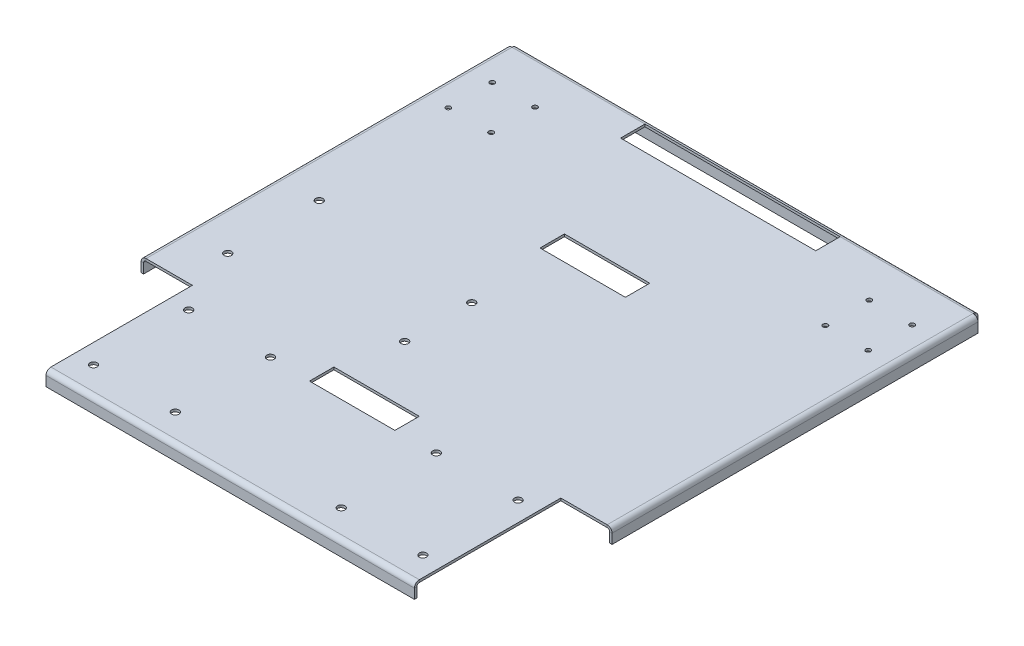
from build123d import *

# Parameters (mm, degrees)
SKETCH1_W          = 189
SKETCH1_H          = 208
BASE_FLANGE1_DEPTH = 1
EDGE_FLANGE1_DEPTH = 189
EDGE_FLANGE2_DEPTH = 208
EDGE_FLANGE3_DEPTH = 189
EDGE_FLANGE4_DEPTH = 208
SKETCH17_W         = 21
SKETCH17_H         = 60
CUT_EXTRUDE1_DEPTH = 144.472122728
SKETCH18_W         = 80
SKETCH18_H         = 10
CUT_EXTRUDE2_DEPTH = 10
SKETCH20_R         = 1.5
CUT_EXTRUDE3_DEPTH = 10
SKETCH21_R         = 1
CUT_EXTRUDE4_DEPTH = 10
SKETCH22_R         = 1.5
CUT_EXTRUDE5_DEPTH = 10
SKETCH23_W         = 35
SKETCH23_H         = 10
CUT_EXTRUDE6_DEPTH = 10


# Sheet-metal steps are written as plain solids
with BuildPart() as part:
    # Sketch1 → Base-Flange1 (new body)
    with BuildSketch(Plane(origin=(0, 0, 0), x_dir=(1, 0, 0), z_dir=(0, 1, 0))):
        Rectangle(SKETCH1_W, SKETCH1_H)
    extrude(amount=-BASE_FLANGE1_DEPTH)

    # Edge-Flange1 section (across the edge) → Edge-Flange1 (add)
    with BuildSketch(Plane(origin=(94.5, -1, 105), x_dir=(0, 0, -1), z_dir=(-1, 0, 0))):
        with BuildLine():
            Line((-1, 1), (-1, 5))
            Line((-1, 5), (0, 5))
            Line((0, 5), (0, 1))
            ThreePointArc((0, 1), (0.292893219, 0.292893219), (1, 0))
            Line((1, 0), (1, -1))
            ThreePointArc((1, -1), (-0.414213562, -0.414213562), (-1, 1))
        make_face()
    extrude(amount=EDGE_FLANGE1_DEPTH)

    # Edge-Flange2 section (across the edge) → Edge-Flange2 (add)
    with BuildSketch(Plane(origin=(95.5, -1, -104), x_dir=(-1, 0, 0), z_dir=(0, 0, 1))):
        with BuildLine():
            Line((-1, 1), (-1, 5))
            Line((-1, 5), (0, 5))
            Line((0, 5), (0, 1))
            ThreePointArc((0, 1), (0.292893219, 0.292893219), (1, 0))
            Line((1, 0), (1, -1))
            ThreePointArc((1, -1), (-0.414213562, -0.414213562), (-1, 1))
        make_face()
    extrude(amount=EDGE_FLANGE2_DEPTH)

    # Edge-Flange3 section (across the edge) → Edge-Flange3 (add)
    with BuildSketch(Plane(origin=(-94.5, -1, -105), x_dir=(0, 0, 1), z_dir=(1, 0, 0))):
        with BuildLine():
            Line((-1, 1), (-1, 5))
            Line((-1, 5), (0, 5))
            Line((0, 5), (0, 1))
            ThreePointArc((0, 1), (0.292893219, 0.292893219), (1, 0))
            Line((1, 0), (1, -1))
            ThreePointArc((1, -1), (-0.414213562, -0.414213562), (-1, 1))
        make_face()
    extrude(amount=EDGE_FLANGE3_DEPTH)

    # Edge-Flange4 section (across the edge) → Edge-Flange4 (add)
    with BuildSketch(Plane(origin=(-95.5, -1, 104), x_dir=(1, 0, 0), z_dir=(0, 0, -1))):
        with BuildLine():
            Line((-1, 1), (-1, 5))
            Line((-1, 5), (0, 5))
            Line((0, 5), (0, 1))
            ThreePointArc((0, 1), (0.292893219, 0.292893219), (1, 0))
            Line((1, 0), (1, -1))
            ThreePointArc((1, -1), (-0.414213562, -0.414213562), (-1, 1))
        make_face()
    extrude(amount=EDGE_FLANGE4_DEPTH)

    # Sketch17 → Cut-Extrude1 (cut, through all)
    with BuildSketch(Plane(origin=(0, 0, 0), x_dir=(1, 0, 0), z_dir=(0, 1, 0))):
        with Locations((86, -76)):
            Rectangle(SKETCH17_W, SKETCH17_H)
        with Locations((-86, -76)):
            Rectangle(SKETCH17_W, SKETCH17_H)
    extrude(amount=-CUT_EXTRUDE1_DEPTH, mode=Mode.SUBTRACT)

    # Sketch18 → Cut-Extrude2 (cut)
    with BuildSketch(Plane(origin=(0, 0, 0), x_dir=(1, 0, 0), z_dir=(0, 1, 0))):
        with Locations((0, 99)):
            Rectangle(SKETCH18_W, SKETCH18_H)
    extrude(amount=-CUT_EXTRUDE2_DEPTH, mode=Mode.SUBTRACT)

    # Sketch20 → Cut-Extrude3 (cut)
    with BuildSketch(Plane(origin=(0, 0, 0), x_dir=(1, 0, 0), z_dir=(0, 1, 0))):
        with Locations(Location((-79.5844, -27.41485418, 0), (0, 0, 270))):
            Circle(SKETCH20_R)
        with Locations(Location((-12.0844, -22.41485418, 0), (0, 0, 270))):
            Circle(SKETCH20_R)
        with Locations(Location((-12.0844, 5.08514582, 0), (0, 0, 270))):
            Circle(SKETCH20_R)
        with Locations(Location((-79.5844, 10.08514582, 0), (0, 0, 270))):
            Circle(SKETCH20_R)
    extrude(amount=-CUT_EXTRUDE3_DEPTH, mode=Mode.SUBTRACT)

    # Sketch21 → Cut-Extrude4 (cut)
    with BuildSketch(Plane(origin=(0, 0, 0), x_dir=(1, 0, 0), z_dir=(0, 1, 0))):
        with Locations(Location((68.5, 87.449623923, 0), (0, 0, 270))):
            Circle(SKETCH21_R)
        with Locations(Location((86.058283099, 87.449623923, 0), (0, 0, 270))):
            Circle(SKETCH21_R)
        with Locations(Location((68.5, 69.449623923, 0), (0, 0, 270))):
            Circle(SKETCH21_R)
        with Locations(Location((86.058283099, 69.449623923, 0), (0, 0, 270))):
            Circle(SKETCH21_R)
        with Locations(Location((-86.058283099, 87.449623923, 0), (0, 0, 270))):
            Circle(SKETCH21_R)
        with Locations(Location((-86.058283099, 69.449623923, 0), (0, 0, 270))):
            Circle(SKETCH21_R)
        with Locations(Location((-68.5, 69.449623923, 0), (0, 0, 270))):
            Circle(SKETCH21_R)
        with Locations(Location((-68.5, 87.449623923, 0), (0, 0, 270))):
            Circle(SKETCH21_R)
    extrude(amount=-CUT_EXTRUDE4_DEPTH, mode=Mode.SUBTRACT)

    # Sketch22 → Cut-Extrude5 (cut)
    with BuildSketch(Plane(origin=(0, 0, 0), x_dir=(1, 0, 0), z_dir=(0, 1, 0))):
        with Locations(Location((67.5, -55.5, 0), (0, 0, 270))):
            Circle(SKETCH22_R)
        with Locations(Location((34, -55.5, 0), (0, 0, 270))):
            Circle(SKETCH22_R)
        with Locations(Location((34, -94.5, 0), (0, 0, 270))):
            Circle(SKETCH22_R)
        with Locations(Location((67.5, -94.5, 0), (0, 0, 270))):
            Circle(SKETCH22_R)
        with Locations(Location((-67.5, -94.5, 0), (0, 0, 270))):
            Circle(SKETCH22_R)
        with Locations(Location((-34, -94.5, 0), (0, 0, 270))):
            Circle(SKETCH22_R)
        with Locations(Location((-34, -55.5, 0), (0, 0, 270))):
            Circle(SKETCH22_R)
        with Locations(Location((-67.5, -55.5, 0), (0, 0, 270))):
            Circle(SKETCH22_R)
    extrude(amount=-CUT_EXTRUDE5_DEPTH, mode=Mode.SUBTRACT)

    # Sketch23 → Cut-Extrude6 (cut)
    with BuildSketch(Plane(origin=(0, 0, 0), x_dir=(1, 0, 0), z_dir=(0, 1, 0))):
        with Locations((0, 43.4732)):
            Rectangle(SKETCH23_W, SKETCH23_H)
        with Locations((0, -51)):
            Rectangle(SKETCH23_W, SKETCH23_H)
    extrude(amount=-CUT_EXTRUDE6_DEPTH, mode=Mode.SUBTRACT)


solid = part.part
